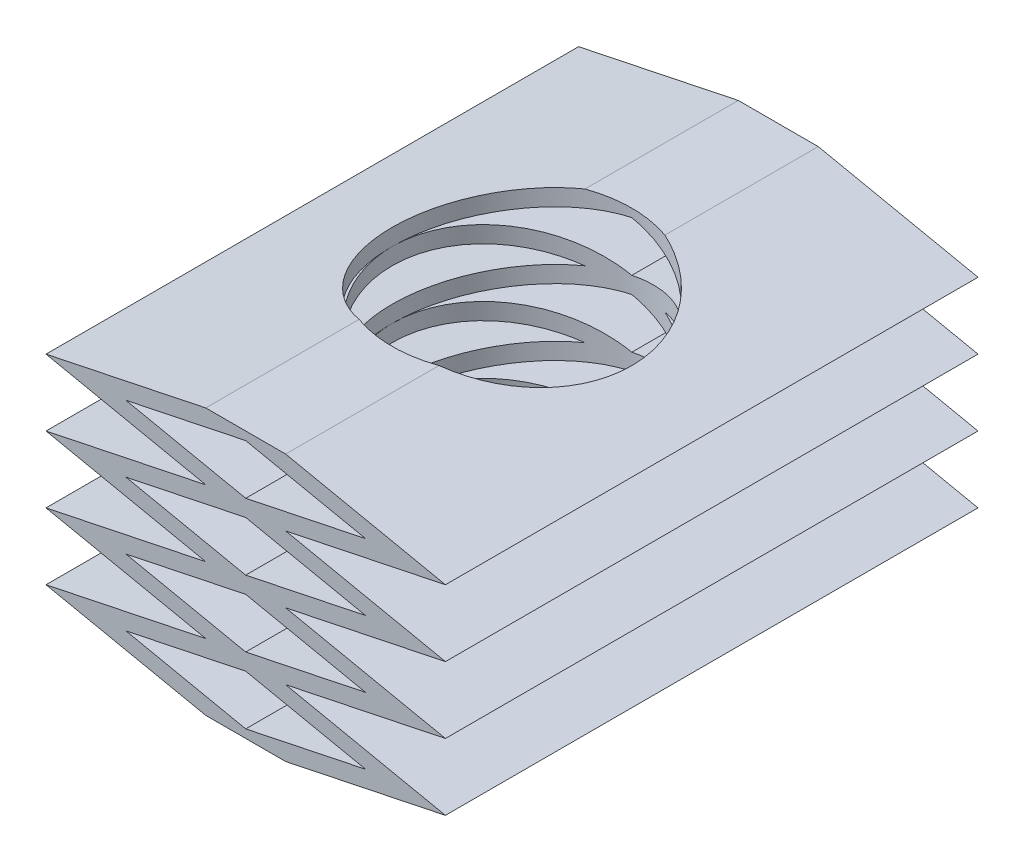
from build123d import *

# Parameters (mm, degrees)
BOSS_EXTRUDE3_DEPTH = 10
LPATTERN1_COUNT     = 4
LPATTERN1_PITCH     = 1.25
SKETCH3_R           = 2.25
CUT_EXTRUDE1_DEPTH  = 12.792476415


with BuildPart() as part:
    # Sketch2 → Boss-Extrude3 (new body)
    with BuildSketch(Plane.XY):
        Polygon((-0.75, 0), (0.75, 0), (3.75, 0.625), (0.75, 1.25), (-0.75, 1.25), (-3.75, 0.625), align=None)
        Polygon((-2.25, 0.625), (0, 1.09375), (2.25, 0.625), (0, 0.15625), align=None, mode=Mode.SUBTRACT)
    boss_extrude3 = extrude(amount=BOSS_EXTRUDE3_DEPTH)

    # LPattern1: Boss-Extrude3 ×4
    with Locations(*[(0, i * LPATTERN1_PITCH, 0) for i in range(1, LPATTERN1_COUNT)]):
        add(boss_extrude3)

    # Sketch3 → Cut-Extrude1 (cut, through all)
    with BuildSketch(Plane.XZ):
        with Locations((0, 5)):
            Circle(SKETCH3_R)
    extrude(amount=-CUT_EXTRUDE1_DEPTH, mode=Mode.SUBTRACT)


solid = part.part
